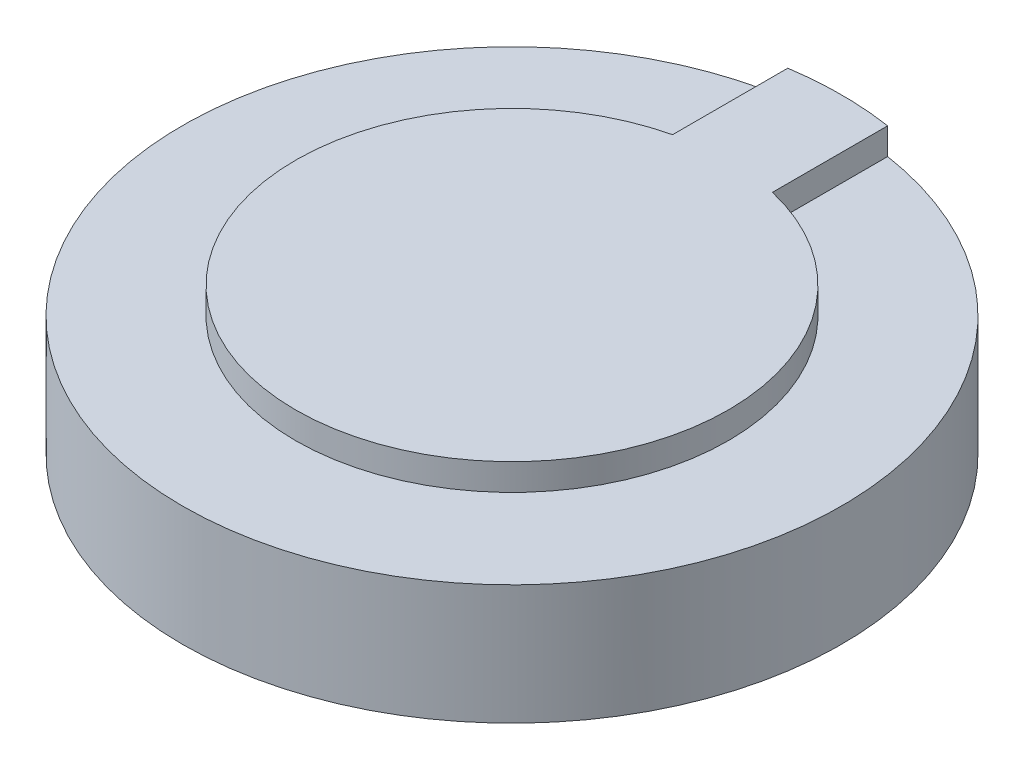
from build123d import *
from build123d.topology import SkipClean

# Parameters (mm, degrees)
BOSS_EXTRUDE1_START = 0.8
BOSS_EXTRUDE1_DEPTH = 0.8


with BuildPart() as part:
    # Sketch1 → Revolve1 (revolve)
    with BuildSketch(Plane(origin=(0, 0, 0), x_dir=(0, 0, -1), z_dir=(1, 0, 0))):
        Polygon((0, 0), (9.9, 0), (9.9, 3.6), (6.5, 3.6), (6.5, 4.4), (0, 4.4), align=None)
    revolve(axis=Axis((0, 4.4, 0), (0, -1, 0)))

    # Sketch2 → Boss-Extrude1 (add)
    with SkipClean():  # the faces are left unmerged after this step: merging them gives an invalid solid
        with BuildSketch(Plane(origin=(0, 3.6, 0), x_dir=(1, 0, 0), z_dir=(0, 1, 0)).offset(BOSS_EXTRUDE1_START)):
            with BuildLine():
                Line((-1.5, 6.32455532), (1.5, 6.32455532))
                Line((1.5, 6.32455532), (1.5, 9.785703858))
                ThreePointArc((1.5, 9.785703858), (0, 9.9), (-1.5, 9.785703858))
                Line((-1.5, 9.785703858), (-1.5, 6.32455532))
            make_face()
        extrude(amount=-BOSS_EXTRUDE1_DEPTH)


solid = part.part
